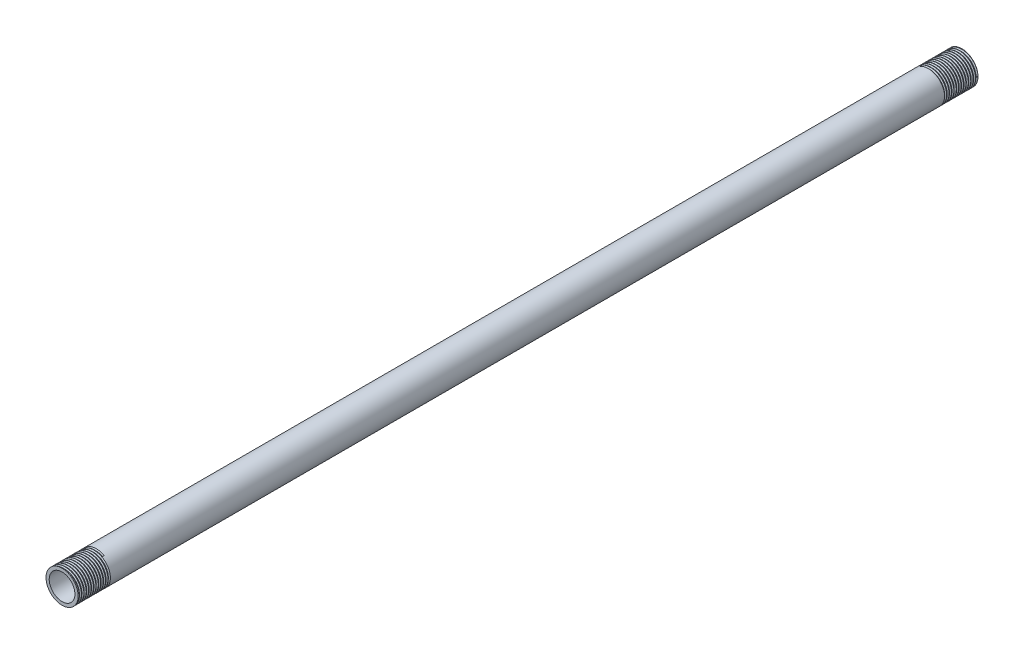
from build123d import *

# Parameters (mm, degrees)
SKETCH1_R           = 10
BOSS_EXTRUDE1_DEPTH = 560
SHELL1_T            = -2
THREAD1_PITCH       = 1.5
THREAD2_PITCH       = 1.5


with BuildPart() as part:
    # Sketch1 → Boss-Extrude1 (new body)
    with BuildSketch(Plane.XY):
        Circle(SKETCH1_R)
    extrude(amount=BOSS_EXTRUDE1_DEPTH)

    # Shell1
    shell1_openings = [part.faces().sort_by_distance(p)[0] for p in [
        (0, 0, 560),
        (0, 0, 0),
    ]]
    offset(amount=SHELL1_T, openings=shell1_openings, kind=Kind.INTERSECTION)

    # Thread1: the profile of Thread Profile1 profile screwed along a right-hand helix of 13.333333 turns, 8 arcs to a turn; built about Z, then put on its axis
    thread1_z = Axis((0, 0, 0), (0, 0, 1))
    thread1_corners = [(10.0003, 0, -0.000173205), (10.0003, 0, 1.312673201), (9.188101187, 0, 0.843749998), (9.188101187, 0, 0.468749998)]
    with BuildLine(mode=Mode.PRIVATE) as thread1_profile:
        Line(thread1_corners[0], thread1_corners[1])
        Line(thread1_corners[1], thread1_corners[2])
        Line(thread1_corners[2], thread1_corners[3])
        Line(thread1_corners[3], thread1_corners[0])
    thread1_cap = Face(thread1_profile.wire())
    thread1_turn_angles = [0, 22.5, 45, 67.5, 90, 112.5, 135, 157.5, 180, 202.5, 225, 247.5, 270, 292.5, 315, 337.5, 360]
    thread1_turn_weights = [1, 0.9238795325112867, 1, 0.9238795325112867, 1, 0.9238795325112867, 1, 0.9238795325112867, 1, 0.9238795325112867, 1, 0.9238795325112867, 1, 0.9238795325112867, 1, 0.9238795325112867, 1]
    thread1_turn_rails = [Edge.make_bspline([Vector(p[0], p[1], 0).rotate(thread1_z, thread1_turn_angles[k]) / thread1_turn_weights[k] + Vector(0, 0, p[2] + THREAD1_PITCH * thread1_turn_angles[k] / 360) for k in range(17)], [0, 0, 0, 1, 1, 2, 2, 3, 3, 4, 4, 5, 5, 6, 6, 7, 7, 8, 8, 8], 2, thread1_turn_weights) for p in thread1_corners]
    thread1_turn_sides = [Face.make_surface_from_curves(thread1_turn_rails[p[0]], thread1_turn_rails[p[1]]) for p in [(0, 1), (1, 2), (2, 3), (3, 0)]]
    thread1_last_angles = [4680, 4702.5, 4725, 4747.5, 4770, 4785, 4800]
    thread1_last_weights = [1, 0.9238795325112867, 1, 0.9238795325112867, 1, 0.9659258262890703, 1]
    thread1_last_rails = [Edge.make_bspline([Vector(p[0], p[1], 0).rotate(thread1_z, thread1_last_angles[k]) / thread1_last_weights[k] + Vector(0, 0, p[2] + THREAD1_PITCH * thread1_last_angles[k] / 360) for k in range(7)], [0, 0, 0, 1, 1, 2, 2, 3, 3, 3], 2, thread1_last_weights) for p in thread1_corners]
    thread1_last_sides = [Face.make_surface_from_curves(thread1_last_rails[p[0]], thread1_last_rails[p[1]]) for p in [(0, 1), (1, 2), (2, 3), (3, 0)]]
    thread1 = Plane(origin=(0, 0, 0), x_dir=(1, 0, 0), z_dir=(0, 0, 1)) * Solid(Shell([*[p.moved(Location((0, 0, THREAD1_PITCH * i))) for i in range(13) for p in thread1_turn_sides], *thread1_last_sides, thread1_cap, thread1_cap.rotate(thread1_z, 4800).moved(Location((0, 0, THREAD1_PITCH * 4800 / 360)))]))
    add(thread1, mode=Mode.SUBTRACT)

    # Thread2: the profile of Thread Profile2 profile screwed along a right-hand helix of 13.333333 turns, 8 arcs to a turn; built about Z, then put on its axis
    thread2_z = Axis((0, 0, 0), (0, 0, 1))
    thread2_corners = [(10.0003, 0, -0.000173205), (10.0003, 0, 1.312673201), (9.188101187, 0, 0.843749998), (9.188101187, 0, 0.468749998)]
    with BuildLine(mode=Mode.PRIVATE) as thread2_profile:
        Line(thread2_corners[0], thread2_corners[1])
        Line(thread2_corners[1], thread2_corners[2])
        Line(thread2_corners[2], thread2_corners[3])
        Line(thread2_corners[3], thread2_corners[0])
    thread2_cap = Face(thread2_profile.wire())
    thread2_turn_angles = [0, 22.5, 45, 67.5, 90, 112.5, 135, 157.5, 180, 202.5, 225, 247.5, 270, 292.5, 315, 337.5, 360]
    thread2_turn_weights = [1, 0.9238795325112867, 1, 0.9238795325112867, 1, 0.9238795325112867, 1, 0.9238795325112867, 1, 0.9238795325112867, 1, 0.9238795325112867, 1, 0.9238795325112867, 1, 0.9238795325112867, 1]
    thread2_turn_rails = [Edge.make_bspline([Vector(p[0], p[1], 0).rotate(thread2_z, thread2_turn_angles[k]) / thread2_turn_weights[k] + Vector(0, 0, p[2] + THREAD2_PITCH * thread2_turn_angles[k] / 360) for k in range(17)], [0, 0, 0, 1, 1, 2, 2, 3, 3, 4, 4, 5, 5, 6, 6, 7, 7, 8, 8, 8], 2, thread2_turn_weights) for p in thread2_corners]
    thread2_turn_sides = [Face.make_surface_from_curves(thread2_turn_rails[p[0]], thread2_turn_rails[p[1]]) for p in [(0, 1), (1, 2), (2, 3), (3, 0)]]
    thread2_last_angles = [4680, 4702.5, 4725, 4747.5, 4770, 4785, 4800]
    thread2_last_weights = [1, 0.9238795325112867, 1, 0.9238795325112867, 1, 0.9659258262890703, 1]
    thread2_last_rails = [Edge.make_bspline([Vector(p[0], p[1], 0).rotate(thread2_z, thread2_last_angles[k]) / thread2_last_weights[k] + Vector(0, 0, p[2] + THREAD2_PITCH * thread2_last_angles[k] / 360) for k in range(7)], [0, 0, 0, 1, 1, 2, 2, 3, 3, 3], 2, thread2_last_weights) for p in thread2_corners]
    thread2_last_sides = [Face.make_surface_from_curves(thread2_last_rails[p[0]], thread2_last_rails[p[1]]) for p in [(0, 1), (1, 2), (2, 3), (3, 0)]]
    thread2 = Plane(origin=(0, 0, 560), x_dir=(-1, 0, 0), z_dir=(0, 0, -1)) * Solid(Shell([*[p.moved(Location((0, 0, THREAD2_PITCH * i))) for i in range(13) for p in thread2_turn_sides], *thread2_last_sides, thread2_cap, thread2_cap.rotate(thread2_z, 4800).moved(Location((0, 0, THREAD2_PITCH * 4800 / 360)))]))
    add(thread2, mode=Mode.SUBTRACT)


solid = part.part
